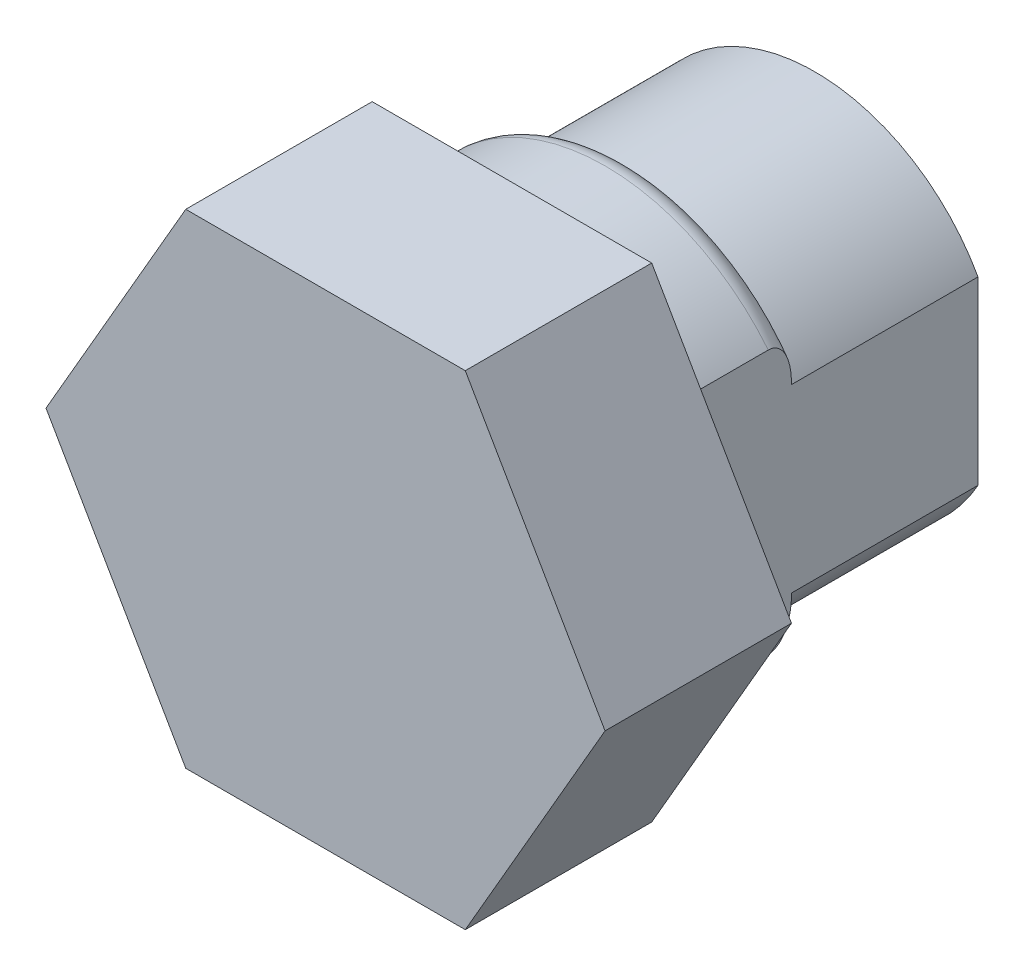
from build123d import *

# Parameters (mm, degrees)
SKIZZE1_R                       = 8
AUFSATZ_LINEAR_AUSTRAGEN1_DEPTH = 8
SKIZZE2_R                       = 9
AUFSATZ_LINEAR_AUSTRAGEN2_DEPTH = 5
AUFSATZ_LINEAR_AUSTRAGEN3_DEPTH = 8
SKIZZE4_W                       = 3
SKIZZE4_H                       = 19.049807725
SCHNITT_LINEAR_AUSTRAGEN1_DEPTH = 13
VERRUNDUNG1_R                   = 1
SKIZZE5_W                       = 1
SKIZZE5_H                       = 3.315694734
AUFSATZ_LINEAR_AUSTRAGEN4_DEPTH = 13


with BuildPart() as part:
    # Skizze1 → Aufsatz-Linear austragen1 (new body)
    with BuildSketch(Plane.XY):
        Circle(SKIZZE1_R)
    extrude(amount=AUFSATZ_LINEAR_AUSTRAGEN1_DEPTH)

    # Skizze2 → Aufsatz-Linear austragen2 (add)
    with BuildSketch(Plane.XY.offset(8)):
        Circle(SKIZZE2_R)
    extrude(amount=AUFSATZ_LINEAR_AUSTRAGEN2_DEPTH)

    # Skizze3 → Aufsatz-Linear austragen3 (add)
    with BuildSketch(Plane.XY.offset(13)):
        Polygon((11.995271167, 0), (5.997635583, 10.388209556), (-5.997635583, 10.388209556), (-11.995271167, 0), (-5.997635583, -10.388209556), (5.997635583, -10.388209556), align=None)
    extrude(amount=AUFSATZ_LINEAR_AUSTRAGEN3_DEPTH)

    # Skizze4 → Schnitt-Linear austragen1 (cut)
    with BuildSketch(Plane(origin=(0, 0, 0), x_dir=(-1, 0, 0), z_dir=(0, 0, -1))):
        with Locations((-8.5, -0.043792661)):
            Rectangle(SKIZZE4_W, SKIZZE4_H)
        with Locations((8.5, -0.043792661)):
            Rectangle(SKIZZE4_W, SKIZZE4_H)
    extrude(amount=-SCHNITT_LINEAR_AUSTRAGEN1_DEPTH, mode=Mode.SUBTRACT)

    # Verrundung1
    verrundung1_edges = [part.edges().sort_by_distance(p)[0] for p in [
        (0, -9, 8),
        (0, 9, 8),
    ]]
    fillet(verrundung1_edges, radius=VERRUNDUNG1_R - 0.0001)  # a hair under: the kernel refuses the full size

    # Skizze5 → Aufsatz-Linear austragen4 (add)
    with BuildSketch(Plane(origin=(0, 0, 13), x_dir=(-1, 0, 0), z_dir=(0, 0, -1))):
        with Locations((0, -8.730362189)):
            Rectangle(SKIZZE5_W, SKIZZE5_H)
    extrude(amount=AUFSATZ_LINEAR_AUSTRAGEN4_DEPTH)


solid = part.part
